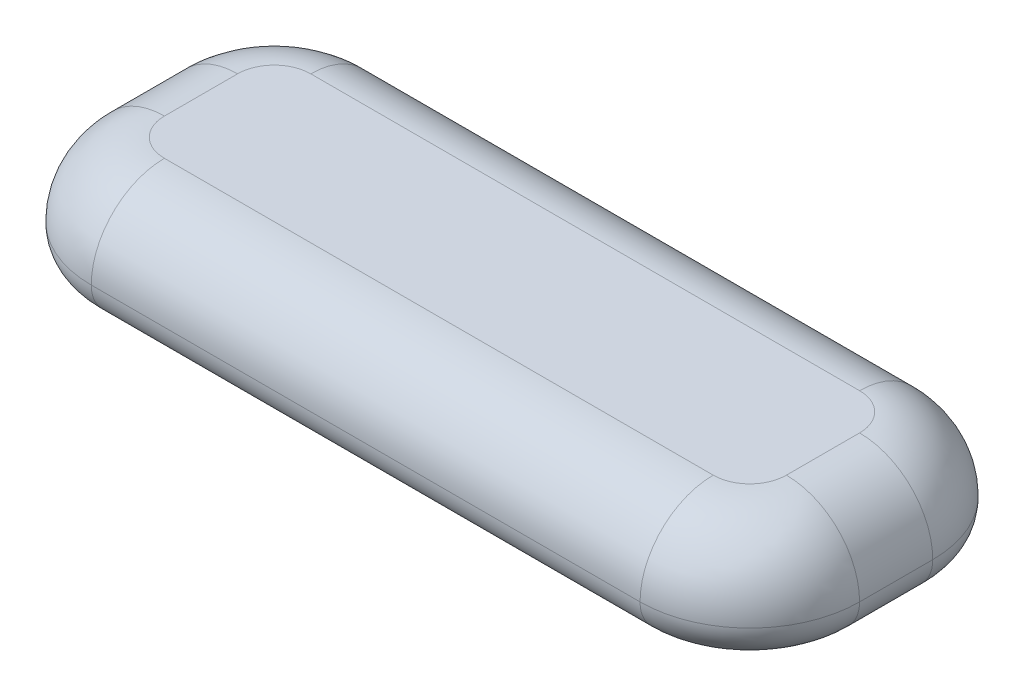
from build123d import *

# Parameters (mm, degrees)
EXTRUDE_1_DEPTH = 10
SHELL_2_T       = 5
FILLET_3_R      = 10
FILLET_4_R      = 5
SKETCH_2_R      = 2.8
EXTRUDE_2_DEPTH = 8


# Some blends are built 0.0001 mm under size
with BuildPart() as part:
    # 草图1 → 凸台-拉伸1 (new body)
    with BuildSketch(Plane(origin=(0, 0, 0), x_dir=(1, 0, 0), z_dir=(0, 1, 0))):
        with BuildLine():
            Line((-37.5, 15), (37.5, 15))
            ThreePointArc((37.5, 15), (44.571067812, 12.071067812), (47.5, 5))
            Line((47.5, 5), (47.5, -5))
            ThreePointArc((47.5, -5), (44.571067812, -12.071067812), (37.5, -15))
            Line((37.5, -15), (-37.5, -15))
            ThreePointArc((-37.5, -15), (-44.571067812, -12.071067812), (-47.5, -5))
            Line((-47.5, -5), (-47.5, 5))
            ThreePointArc((-47.5, 5), (-44.571067812, 12.071067812), (-37.5, 15))
        make_face()
    extrude(amount=EXTRUDE_1_DEPTH)

    # 抽壳2
    shell_2_openings = [part.faces().sort_by_distance(p)[0] for p in [
        (0, 0, 0),
    ]]
    offset(amount=SHELL_2_T, openings=shell_2_openings, kind=Kind.INTERSECTION)

    # 圆角3
    # the kernel refuses this fillet: 10 mm, written as the material it takes off along each edge
    with BuildSketch(Plane(origin=(37.5, 15, 5), x_dir=(1, 0, 0), z_dir=(0, 0, -1))) as fillet_3_piece_1:
        with BuildLine():
            CenterArc((15 - FILLET_3_R, FILLET_3_R), FILLET_3_R, 270, 90)
            Line((15 - FILLET_3_R, 0), (15, 0))
            Line((15, 0), (15, FILLET_3_R))
        make_face()
    revolve(axis=Axis((37.5, 15, 5), (0, -1, 0)), revolution_arc=90, mode=Mode.SUBTRACT)
    with BuildSketch(Plane(origin=(52.5, 15, 5), x_dir=(0, -1, 0), z_dir=(0, 0, -1)), Plane(origin=(-52.5, 15, -5), x_dir=(0, -1, 0), z_dir=(0, 0, 1))) as fillet_3_piece_2:
        with BuildLine():
            CenterArc((FILLET_3_R, FILLET_3_R), FILLET_3_R, 180, 90)
            Line((0, FILLET_3_R), (0, 0))
            Line((0, 0), (FILLET_3_R, 0))
        make_face()
    extrude(amount=10, mode=Mode.SUBTRACT)
    with BuildSketch(Plane(origin=(37.5, 15, -5), x_dir=(0, 0, -1), z_dir=(-1, 0, 0))) as fillet_3_piece_3:
        with BuildLine():
            CenterArc((15 - FILLET_3_R, FILLET_3_R), FILLET_3_R, 270, 90)
            Line((15 - FILLET_3_R, 0), (15, 0))
            Line((15, 0), (15, FILLET_3_R))
        make_face()
    revolve(axis=Axis((37.5, 15, -5), (0, -1, 0)), revolution_arc=90, mode=Mode.SUBTRACT)
    with BuildSketch(Plane(origin=(37.5, 15, -20), x_dir=(0, -1, 0), z_dir=(-1, 0, 0)), Plane(origin=(-37.5, 15, 20), x_dir=(0, -1, 0), z_dir=(1, 0, 0))) as fillet_3_piece_4:
        with BuildLine():
            CenterArc((FILLET_3_R, FILLET_3_R), FILLET_3_R, 180, 90)
            Line((0, FILLET_3_R), (0, 0))
            Line((0, 0), (FILLET_3_R, 0))
        make_face()
    extrude(amount=75, mode=Mode.SUBTRACT)
    with BuildSketch(Plane(origin=(-37.5, 15, -5), x_dir=(-1, 0, 0), z_dir=(0, 0, 1))) as fillet_3_piece_5:
        with BuildLine():
            CenterArc((15 - FILLET_3_R, FILLET_3_R), FILLET_3_R, 270, 90)
            Line((15 - FILLET_3_R, 0), (15, 0))
            Line((15, 0), (15, FILLET_3_R))
        make_face()
    revolve(axis=Axis((-37.5, 15, -5), (0, -1, 0)), revolution_arc=90, mode=Mode.SUBTRACT)
    with BuildSketch(Plane(origin=(-37.5, 15, 5), x_dir=(0, 0, 1), z_dir=(1, 0, 0))) as fillet_3_piece_6:
        with BuildLine():
            CenterArc((15 - FILLET_3_R, FILLET_3_R), FILLET_3_R, 270, 90)
            Line((15 - FILLET_3_R, 0), (15, 0))
            Line((15, 0), (15, FILLET_3_R))
        make_face()
    revolve(axis=Axis((-37.5, 15, 5), (0, -1, 0)), revolution_arc=90, mode=Mode.SUBTRACT)

    # 圆角4
    fillet_4_edges = [part.edges().sort_by_distance(p)[0] for p in [
        (52.5, 0, 0),
        (48.106601718, 0, 15.606601718),
        (0, 0, 20),
        (-48.106601718, 0, 15.606601718),
        (-52.5, 0, 0),
        (-48.106601718, 0, -15.606601718),
        (0, 0, -20),
        (48.106601718, 0, -15.606601718),
    ]]
    fillet(fillet_4_edges, radius=FILLET_4_R - 0.0001)  # a hair under: the kernel refuses the full size

    # 草图2 → 凸台-拉伸2 (add)
    # profile 1 of 2: a face of its own
    with BuildSketch(Plane(origin=(0, 10, 0), x_dir=(-1, 0, 0), z_dir=(0, -1, 0))):
        with Locations(Location((37, 0, 0), (0, 0, 270))):
            Circle(SKETCH_2_R)
        Polygon((34.825, -0.7), (34.825, 0.7), (36.3, 0.7), (36.3, 2.175), (37.7, 2.175), (37.7, 0.7), (39.175, 0.7), (39.175, -0.7), (37.7, -0.7), (37.7, -2.175), (36.3, -2.175), (36.3, -0.7), align=None, mode=Mode.SUBTRACT)
    # profile 2 of 2: a face of its own
    with BuildSketch(Plane(origin=(0, 10, 0), x_dir=(-1, 0, 0), z_dir=(0, -1, 0))):
        with Locations(Location((-37, 0, 0), (0, 0, 90))):
            Circle(SKETCH_2_R)
        Polygon((-37.7, 0.7), (-37.7, 2.175), (-36.3, 2.175), (-36.3, 0.7), (-34.825, 0.7), (-34.825, -0.7), (-36.3, -0.7), (-36.3, -2.175), (-37.7, -2.175), (-37.7, -0.7), (-39.175, -0.7), (-39.175, 0.7), align=None, mode=Mode.SUBTRACT)
    extrude(amount=EXTRUDE_2_DEPTH)


solid = part.part
